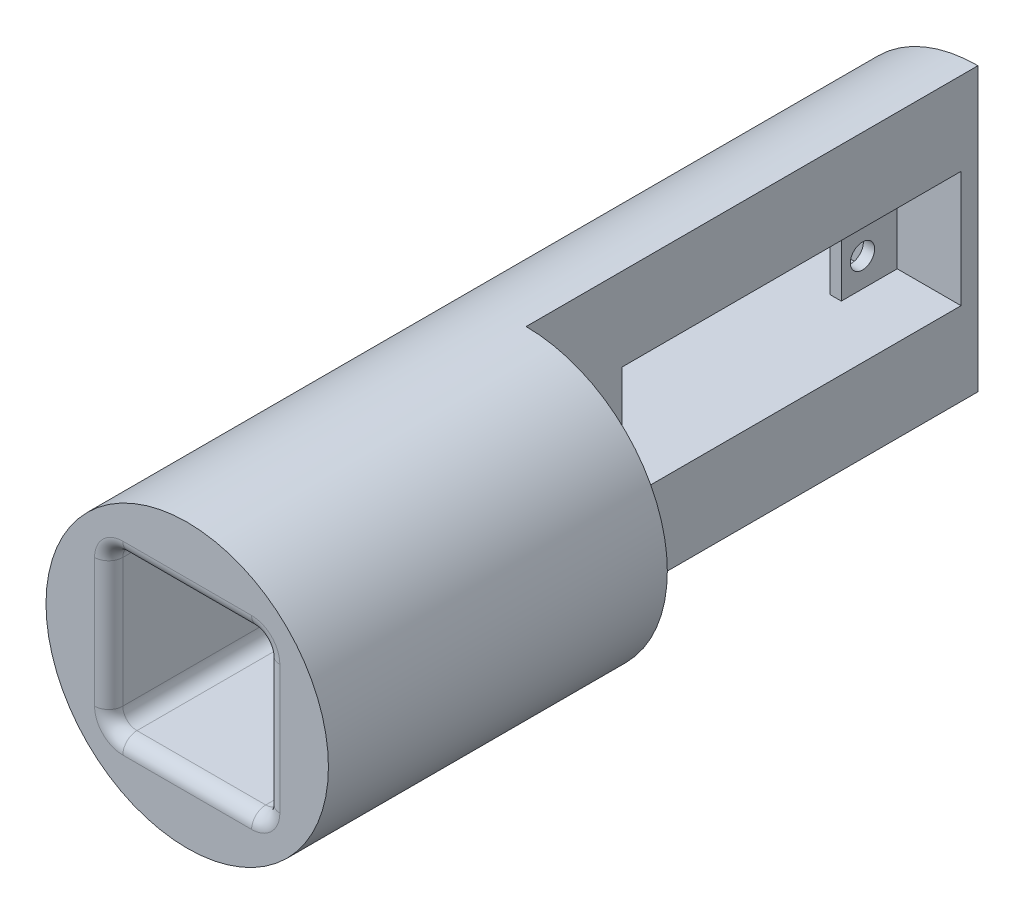
from build123d import *

# Parameters (mm, degrees)
SKETCH1_R           = 25
SKETCH1_W           = 27.8
SKETCH1_H           = 27.8
BOSS_EXTRUDE1_DEPTH = 55
BOSS_EXTRUDE2_START = 5
SKETCH2_R           = 25
BOSS_EXTRUDE2_DEPTH = 5
SKETCH3_W           = 25
SKETCH3_H           = 50
BOSS_EXTRUDE3_DEPTH = 80
FILLET1_R           = 2.5
FILLET2_R           = 2.5
SKETCH21_W          = 60
SKETCH21_H          = 20.6
CUT_EXTRUDE1_DEPTH  = 11.3
SKETCH22_W          = 40.5
SKETCH22_H          = 20.6
CUT_EXTRUDE2_DEPTH  = 93.059763198
CUT_EXTRUDE3_DEPTH  = 88.464278423
SKETCH23_R          = 2.15
CUT_EXTRUDE4_DEPTH  = 93.059763198
CUT_EXTRUDE7_DEPTH  = 27.5
CUT_EXTRUDE8_DEPTH  = 10


with BuildPart() as part:
    # Sketch1 → Boss-Extrude1 (new body)
    with BuildSketch(Plane.XY):
        Circle(SKETCH1_R)
        Rectangle(SKETCH1_W, SKETCH1_H, mode=Mode.SUBTRACT)
    extrude(amount=BOSS_EXTRUDE1_DEPTH)

    # Sketch2 → Boss-Extrude2 (add)
    with BuildSketch(Plane(origin=(0, 0, 0), x_dir=(-1, 0, 0), z_dir=(0, 0, -1)).offset(BOSS_EXTRUDE2_START)):
        Circle(SKETCH2_R)
    extrude(amount=-BOSS_EXTRUDE2_DEPTH)

    # Sketch3 → Boss-Extrude3 (add)
    with BuildSketch(Plane(origin=(0, 0, -5), x_dir=(-1, 0, 0), z_dir=(0, 0, -1))):
        with Locations((12.5, 0)):
            Rectangle(SKETCH3_W, SKETCH3_H)
    extrude(amount=BOSS_EXTRUDE3_DEPTH)

    # Fillet1
    fillet1_edges = [part.edges().sort_by_distance(p)[0] for p in [
        (-13.9, 13.9, 27.5),
        (13.9, 13.9, 27.5),
        (-13.9, -13.9, 27.5),
        (13.9, -13.9, 27.5),
    ]]
    fillet(fillet1_edges, radius=FILLET1_R)

    # Fillet2
    fillet2_edges = [part.edges().sort_by_distance(p)[0] for p in [
        (13.9, 0, 55),
    ]]
    fillet(fillet2_edges, radius=FILLET2_R)

    # Sketch21 → Cut-Extrude1 (cut)
    with BuildSketch(Plane(origin=(0, 0, 0), x_dir=(0, 0, -1), z_dir=(1, 0, 0))):
        with Locations((52, 0)):
            Rectangle(SKETCH21_W, SKETCH21_H)
    extrude(amount=-CUT_EXTRUDE1_DEPTH, mode=Mode.SUBTRACT)

    # Sketch22 → Cut-Extrude2 (cut, through all)
    with BuildSketch(Plane(origin=(0, 0, 0), x_dir=(0, 0, -1), z_dir=(1, 0, 0))):
        with Locations((51.85, 0)):
            Rectangle(SKETCH22_W, SKETCH22_H)
    extrude(amount=-CUT_EXTRUDE2_DEPTH, mode=Mode.SUBTRACT)

    # Sketch18 → Cut-Extrude3 (cut, through all)
    with BuildSketch(Plane.XY.offset(-5)):
        with BuildLine():
            Line((-25, -25), (0, -25))
            ThreePointArc((0, -25), (-17.67766953, -17.67766953), (-25, 0))
            Line((-25, 0), (-25, -25))
        make_face()
        with BuildLine():
            Line((-25, 25), (-25, 0))
            ThreePointArc((-25, 0), (-17.67766953, 17.67766953), (0, 25))
            Line((0, 25), (-25, 25))
        make_face()
    extrude(amount=-CUT_EXTRUDE3_DEPTH, mode=Mode.SUBTRACT)

    # Sketch23 → Cut-Extrude4 (cut, through all)
    with BuildSketch(Plane(origin=(0, 0, 0), x_dir=(0, 0, -1), z_dir=(1, 0, 0))):
        with Locations((75.85, 5.25)):
            Circle(SKETCH23_R)
        with Locations((75.85, -5.25)):
            Circle(SKETCH23_R)
        with Locations((27.85, 5.25)):
            Circle(SKETCH23_R)
        with Locations((27.85, -5.25)):
            Circle(SKETCH23_R)
    extrude(amount=-CUT_EXTRUDE4_DEPTH, mode=Mode.SUBTRACT)

    # Sketch24 → Cut-Extrude7 (cut, symmetric)
    with BuildSketch(Plane(origin=(0, 0, -51.85), x_dir=(-1, 0, 0), z_dir=(0, 0, -1))):
        with BuildLine():
            Line((22.779596133, 10.3), (13.3, 10.3))
            Line((13.3, 10.3), (13.3, -10.3))
            Line((13.3, -10.3), (22.779596133, -10.3))
            ThreePointArc((22.779596133, -10.3), (25, 0), (22.779596133, 10.3))
        make_face()
    extrude(amount=CUT_EXTRUDE7_DEPTH, both=True, mode=Mode.SUBTRACT)

    # Sketch25 → Cut-Extrude8 (cut)
    with BuildSketch(Plane(origin=(0, 0, -24.35), x_dir=(-1, 0, 0), z_dir=(0, 0, -1))):
        with BuildLine():
            Line((13.3, -10.3), (22.779596133, -10.3))
            ThreePointArc((22.779596133, -10.3), (25, 0), (22.779596133, 10.3))
            Line((22.779596133, 10.3), (13.3, 10.3))
            Line((13.3, 10.3), (13.3, -10.3))
        make_face()
    extrude(amount=-CUT_EXTRUDE8_DEPTH, mode=Mode.SUBTRACT)


solid = part.part
